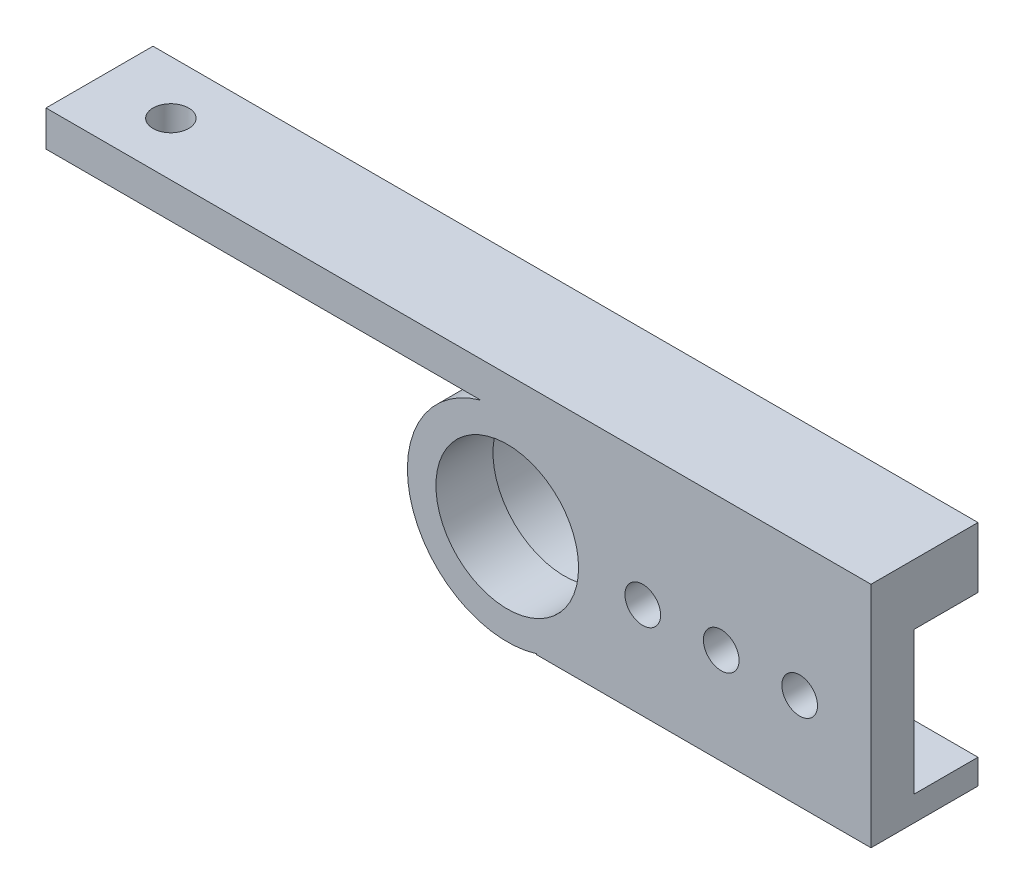
from build123d import *

# Parameters (mm, degrees)
SKETCH_1_W          = 40
SKETCH_1_H          = 20
EXTRUDE_1_DEPTH     = 6
SKETCH_2_R          = 2.5
CUT_EXTRUDE_1_DEPTH = 24.151673806
EXTRUDE_START       = -15
EXTRUDE_2_OUTLINE_R = 11
EXTRUDE_2_DEPTH     = 15
EXTRUDE_START_2     = -8
SKETCH_5_R          = 11
SKETCH_5_R_2        = 10
EXTRUDE_3_DEPTH     = 8
SKETCH_8_W          = 15
SKETCH_8_H          = 5
EXTRUDE_4_DEPTH     = 200
SKETCH_9_W          = 4.403653586
SKETCH_9_H          = 3.736433346
EXTRUDE_5_DEPTH     = 15
SKETCH_13_W         = 87.445921981
SKETCH_13_H         = 18.524474632
CUT_EXTRUDE_2_DEPTH = 184.131783151
SKETCH_14_R         = 2.5
CUT_EXTRUDE_3_DEPTH = 10


# Read off the part's stored shape, not the designer's step: 凸台-拉伸2
with BuildPart() as part:
    # 草图1 → 凸台-拉伸1 (new body)
    with BuildSketch(Plane.XY):
        Rectangle(SKETCH_1_W, SKETCH_1_H)
    extrude(amount=EXTRUDE_1_DEPTH)

    # 草图2 → 切除-拉伸1 (cut, through all)
    with BuildSketch(Plane.XY.offset(6)):
        with Locations((10, 0)):
            Circle(SKETCH_2_R)
        with Locations((-1, 0)):
            Circle(SKETCH_2_R)
        with Locations((-12, 0)):
            Circle(SKETCH_2_R)
    extrude(amount=-CUT_EXTRUDE_1_DEPTH, mode=Mode.SUBTRACT)

    # 凸台-拉伸2 outline → 凸台-拉伸2 (add)
    with BuildSketch(Plane.XY.offset(6).offset(EXTRUDE_START)):
        with BuildLine():
            Line((20, 10), (20, 13.5))
            Line((20, 13.5), (-26.893967141, 13.5))
            Line((-26.893967141, 13.5), (-26.893967141, 13.384337644))
            ThreePointArc((-26.893967141, 13.384337644), (-45, 0), (-26.893967141, -13.384337644))
            Line((-26.893967141, -13.384337644), (-26.893967141, -13.5))
            Line((-26.893967141, -13.5), (20, -13.5))
            Line((20, -13.5), (20, -10))
            Line((20, -10), (-20, -10))
            Line((-20, -10), (-20, -8.660254038))
            ThreePointArc((-20, -8.660254038), (-17, 0), (-20, 8.660254038))
            Line((-20, 8.660254038), (-20, 10))
            Line((-20, 10), (20, 10))
        make_face()
        with Locations((-31, 0)):
            Circle(EXTRUDE_2_OUTLINE_R, mode=Mode.SUBTRACT)
    extrude(amount=EXTRUDE_2_DEPTH)

    # 草图5 → 凸台-拉伸3 (add)
    with BuildSketch(Plane.XY.offset(6).offset(EXTRUDE_START_2)):
        with Locations((-31, 0)):
            Circle(SKETCH_5_R)
        with Locations((-31, 0)):
            Circle(SKETCH_5_R_2, mode=Mode.SUBTRACT)
    extrude(amount=EXTRUDE_3_DEPTH)

    # 草图8 → 凸台-拉伸4 (add)
    with BuildSketch(Plane(origin=(20, 0, 0), x_dir=(0, 0, -1), z_dir=(1, 0, 0))):
        with Locations((1.5, 16)):
            Rectangle(SKETCH_8_W, SKETCH_8_H)
    extrude(amount=-EXTRUDE_4_DEPTH)

    # 草图9 → 凸台-拉伸5 (add, through all)
    with BuildSketch(Plane.XY.offset(6)):
        with Locations((-27.364497847, 13.796597935)):
            Rectangle(SKETCH_9_W, SKETCH_9_H)
    extrude(amount=-EXTRUDE_5_DEPTH)

    # 草图13 → 切除-拉伸2 (cut, through all)
    with BuildSketch(Plane(origin=(0, 18.5, 0), x_dir=(1, 0, 0), z_dir=(0, 1, 0))):
        with Locations((-139.388148112, 3.262237316)):
            Rectangle(SKETCH_13_W, SKETCH_13_H)
    extrude(amount=-CUT_EXTRUDE_2_DEPTH, mode=Mode.SUBTRACT)

    # 草图14 → 切除-拉伸3 (cut)
    with BuildSketch(Plane(origin=(0, 18.5, 0), x_dir=(1, 0, 0), z_dir=(0, 1, 0))):
        with Locations(Location((-85.665187121, 1.5, 0), (0, 0, 270))):
            Circle(SKETCH_14_R)
    extrude(amount=-CUT_EXTRUDE_3_DEPTH, mode=Mode.SUBTRACT)


solid = part.part
